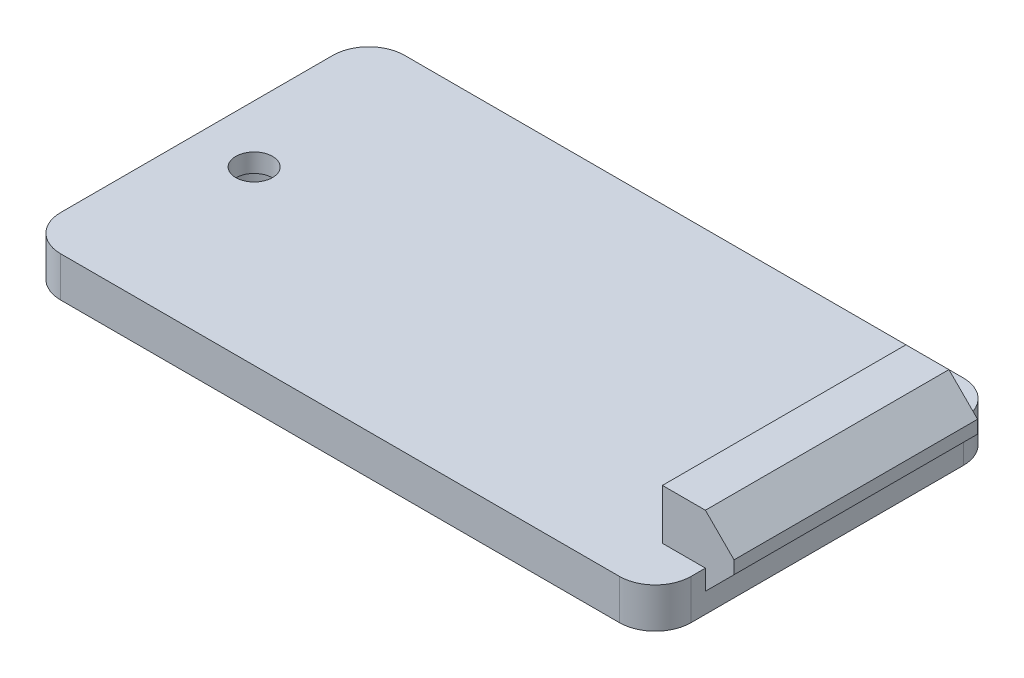
from build123d import *

# Parameters (mm, degrees)
SKETCH1_R           = 1.63195
BOSS_EXTRUDE1_DEPTH = 3.556
SKETCH2_R           = 3.175
SKETCH2_R_2         = 1.63195
CUT_EXTRUDE1_DEPTH  = 1.905
SKETCH3_W           = 21.59
SKETCH3_H           = 6.604
BOSS_EXTRUDE2_DEPTH = 2.54
CHAMFER1_SIZE       = 2.7305
SKETCH4_W           = 21.59
SKETCH4_H           = 4.445
BOSS_EXTRUDE3_DEPTH = 3.81
CUT_EXTRUDE2_DEPTH  = 1.778
CUT_EXTRUDE3_DEPTH  = 1.016


with BuildPart() as part:
    # Sketch1 → Boss-Extrude1 (new body)
    with BuildSketch(Plane(origin=(0, 0, 0), x_dir=(1, 0, 0), z_dir=(0, 1, 0))):
        with BuildLine():
            Line((3.175, 0), (52.705, 0))
            ThreePointArc((52.705, 0), (54.95006403, 0.92993597), (55.88, 3.175))
            Line((55.88, 3.175), (55.88, 27.305))
            ThreePointArc((55.88, 27.305), (54.95006403, 29.55006403), (52.705, 30.48))
            Line((52.705, 30.48), (3.175, 30.48))
            ThreePointArc((3.175, 30.48), (0.92993597, 29.55006403), (0, 27.305))
            Line((0, 27.305), (0, 3.175))
            ThreePointArc((0, 3.175), (0.92993597, 0.92993597), (3.175, 0))
        make_face()
        with Locations(Location((5.08, 15.24, 0), (0, 0, 270))):
            Circle(SKETCH1_R, mode=Mode.SUBTRACT)
    extrude(amount=BOSS_EXTRUDE1_DEPTH)

    # Sketch2 → Cut-Extrude1 (cut)
    with BuildSketch(Plane.XZ):
        with Locations(Location((5.08, -15.24, 0), (0, 0, 270))):
            Circle(SKETCH2_R)
        with Locations(Location((5.08, -15.24, 0), (0, 0, 270))):
            Circle(SKETCH2_R_2, mode=Mode.SUBTRACT)
    extrude(amount=-CUT_EXTRUDE1_DEPTH, mode=Mode.SUBTRACT)

    # Sketch3 → Boss-Extrude2 (add)
    with BuildSketch(Plane(origin=(55.88, 0, 0), x_dir=(0, 0, -1), z_dir=(1, 0, 0))):
        with Locations((15.24, 4.8895)):
            Rectangle(SKETCH3_W, SKETCH3_H)
    extrude(amount=BOSS_EXTRUDE2_DEPTH)

    # Chamfer1
    # the kernel refuses this chamfer: 2.7305 mm, written as the material it takes off along each edge
    with BuildSketch(Plane(origin=(58.42, 1.5875, 2.576980399), x_dir=(-0.9996219169112968, -0.027495876610586327, 0), z_dir=(0, 0, -1))) as chamfer1_piece_1_section:
        Polygon((CHAMFER1_SIZE * 0.999621916911, CHAMFER1_SIZE * 0.0274958766106), (-CHAMFER1_SIZE * 0.0274958766106, CHAMFER1_SIZE * 0.999621916911), (0, 0), align=None)
    chamfer1_piece_1 = extrude(amount=35.633960797, mode=Mode.PRIVATE)
    chamfer1_piece_1 = split(chamfer1_piece_1, bisect_by=Plane(origin=(55.88, 2.498762028, -15.24), z_dir=(1, 0, 0)), keep=Keep.TOP, mode=Mode.PRIVATE)
    add(chamfer1_piece_1, mode=Mode.SUBTRACT)
    with BuildSketch(Plane(origin=(58.42, 8.1915, -33.056980399), x_dir=(-0.9996219169112968, 0.027495876610586327, 0), z_dir=(0, 0, 1))) as chamfer1_piece_2:
        Polygon((CHAMFER1_SIZE * 0.999621916911, CHAMFER1_SIZE * 0.0274958766106), (-CHAMFER1_SIZE * 0.0274958766106, CHAMFER1_SIZE * 0.999621916911), (0, 0), align=None)
    extrude(amount=35.633960797, mode=Mode.SUBTRACT)

    # Sketch4 → Boss-Extrude3 (add)
    with BuildSketch(Plane.ZY.offset(-55.88)):
        with Locations((-15.24, 5.7785)):
            Rectangle(SKETCH4_W, SKETCH4_H)
    extrude(amount=BOSS_EXTRUDE3_DEPTH)

    # Sketch5 → Cut-Extrude2 (cut)
    with BuildSketch(Plane.XZ):
        with BuildLine():
            Line((11.1125, -8.89), (11.143328177, -21.901334365))
            ThreePointArc((11.143328177, -21.901334365), (12.7, -23.1775), (14.256671823, -21.901334365))
            Line((14.256671823, -21.901334365), (14.2875, -8.89))
            ThreePointArc((14.2875, -8.89), (12.7, -7.3025), (11.1125, -8.89))
        make_face()
    extrude(amount=-CUT_EXTRUDE2_DEPTH, mode=Mode.SUBTRACT)

    # Sketch6 → Cut-Extrude3 (cut)
    # profile 1 of 6: a face of its own
    with BuildSketch(Plane.XZ):
        with BuildLine():
            Line((20.72589216, -17.220654297), (18.610052316, -13.731875))
            Line((18.610052316, -13.731875), (18.610052316, -17.239257812))
            add(Edge.make_bspline(
                [(18.610052316, -17.239257812), (18.607921605, -17.298911648), (18.603908362, -17.41127099), (18.573988826, -17.569982619), (18.518975798, -17.705796144), (18.444521967, -17.819701414), (18.350307706, -17.908840339), (18.240659525, -17.973288208), (18.115205248, -18.011784183), (18.027003727, -18.015959341), (17.981253488, -18.018125)],
                knots=[0, 0, 0, 0, 1.265353785, 2.383322319, 3.406079062, 4.354706819, 5.248049079, 6.132478892, 7.031314469, 8, 8, 8, 8], degree=3))
            add(Edge.make_bspline(
                [(17.981253488, -18.018125), (17.925628944, -18.01557639), (17.819929267, -18.010733433), (17.670961125, -17.972499343), (17.543370335, -17.905481858), (17.438491924, -17.811943402), (17.358521489, -17.695032319), (17.30155081, -17.560029656), (17.26595508, -17.407673383), (17.262486044, -17.300235819), (17.260677316, -17.24421875)],
                knots=[0, 0, 0, 0, 1.111277701, 2.111688183, 3.047130546, 3.966217245, 4.892522741, 5.855174746, 6.8817056, 8, 8, 8, 8], degree=3))
            Line((17.260677316, -17.24421875), (17.260677316, -12.536289063))
            add(Edge.make_bspline(
                [(17.260677316, -12.536289063), (17.262572187, -12.468256972), (17.266143267, -12.340043456), (17.305206073, -12.160989669), (17.366968544, -12.007029198), (17.459285684, -11.881642903), (17.576090377, -11.7829468), (17.720352388, -11.715970397), (17.888415477, -11.674546085), (18.009096159, -11.670348704), (18.073030832, -11.668125)],
                knots=[0, 0, 0, 0, 1.196794268, 2.255482655, 3.211935605, 4.097712834, 4.971580063, 5.877259559, 6.875406449, 8, 8, 8, 8], degree=3))
            add(Edge.make_bspline(
                [(18.073030832, -11.668125), (18.130369187, -11.669974867), (18.239975638, -11.673511024), (18.396474454, -11.715522058), (18.538882737, -11.783332619), (18.665877229, -11.881691636), (18.783774274, -11.997589871), (18.88701186, -12.132784611), (18.988065823, -12.273318658), (19.053455797, -12.369934821), (19.086302316, -12.418466797)],
                knots=[0, 0, 0, 0, 1.034588742, 1.977691896, 2.907420409, 3.869016966, 4.868336302, 5.890146147, 6.940183772, 8, 8, 8, 8], degree=3))
            Line((19.086302316, -12.418466797), (21.150052316, -15.875))
            Line((21.150052316, -15.875), (21.150052316, -12.44203125))
            add(Edge.make_bspline(
                [(21.150052316, -12.44203125), (21.152431613, -12.386450379), (21.15699279, -12.279900325), (21.191785167, -12.127790172), (21.251752435, -11.993426334), (21.334496775, -11.876997955), (21.439132723, -11.78285203), (21.564998668, -11.715507081), (21.709047408, -11.675376644), (21.811245079, -11.670607037), (21.864427316, -11.668125)],
                knots=[0, 0, 0, 0, 1.120944038, 2.148880464, 3.127180073, 4.071713149, 5.011111752, 5.94053073, 6.928281018, 8, 8, 8, 8], degree=3))
            add(Edge.make_bspline(
                [(21.864427316, -11.668125), (21.91062512, -11.670167989), (21.999825012, -11.674112644), (22.125749833, -11.714254018), (22.236559279, -11.77883351), (22.330904459, -11.868964724), (22.407145441, -11.982184448), (22.461518851, -12.117301231), (22.493732847, -12.273104653), (22.497456779, -12.383575212), (22.499427316, -12.44203125)],
                knots=[0, 0, 0, 0, 0.978985233, 1.890249527, 2.776095748, 3.683286574, 4.638334066, 5.654599251, 6.75891969, 8, 8, 8, 8], degree=3))
            Line((22.499427316, -12.44203125), (22.499427316, -17.060664063))
            add(Edge.make_bspline(
                [(22.499427316, -17.060664063), (22.499074635, -17.109502482), (22.49840354, -17.202434049), (22.483796167, -17.333215501), (22.465145225, -17.449101652), (22.44121423, -17.518133426), (22.429974191, -17.550556641)],
                knots=[0, 0, 0, 0, 1.177360908, 2.240326254, 3.173506975, 4, 4, 4, 4], degree=3))
            add(Edge.make_bspline(
                [(22.429974191, -17.550556641), (22.41465325, -17.584334411), (22.384257523, -17.65134726), (22.316681693, -17.739976372), (22.239232274, -17.821507427), (22.147044921, -17.889894057), (22.047785728, -17.946839535), (21.942346783, -17.988843564), (21.831987519, -18.012535286), (21.757046771, -18.016253278), (21.719319894, -18.018125)],
                knots=[0, 0, 0, 0, 0.986319285, 1.956791804, 2.954998574, 3.978349394, 5.005554879, 6.000772542, 6.993543447, 8, 8, 8, 8], degree=3))
            add(Edge.make_bspline(
                [(21.719319894, -18.018125), (21.685392022, -18.016994956), (21.619785435, -18.01480978), (21.524768584, -18.003081997), (21.437061413, -17.980363416), (21.332344195, -17.940045949), (21.218113011, -17.874037149), (21.101294302, -17.77750425), (21.006614452, -17.662756973), (20.91818128, -17.533505848), (20.827942882, -17.383055192), (20.761657606, -17.277570507), (20.72589216, -17.220654297)],
                knots=[0, 0, 0, 0, 0.753527253, 1.45710146, 2.120494025, 2.759698616, 3.943682189, 5.031898768, 6.106090348, 7.233993655, 8.507550168, 10, 10, 10, 10], degree=3))
        make_face()
    # profile 2 of 6: a face of its own
    with BuildSketch(Plane.XZ):
        with BuildLine():
            Line((25.277552316, -12.486679688), (25.277552316, -17.203291016))
            add(Edge.make_bspline(
                [(25.277552316, -17.203291016), (25.27592243, -17.265925971), (25.272836346, -17.384521173), (25.236417882, -17.550195902), (25.178343797, -17.693368917), (25.095879346, -17.811117041), (24.994601679, -17.903633987), (24.878895024, -17.970767998), (24.748005393, -18.010523035), (24.656472252, -18.015531202), (24.609065988, -18.018125)],
                knots=[0, 0, 0, 0, 1.262742683, 2.390920895, 3.404851053, 4.363640381, 5.267702689, 6.154016717, 7.043940042, 8, 8, 8, 8], degree=3))
            add(Edge.make_bspline(
                [(24.609065988, -18.018125), (24.551735633, -18.015825108), (24.442466159, -18.011441602), (24.288525009, -17.969590153), (24.15467477, -17.900387033), (24.042725158, -17.803300543), (23.954988046, -17.682001274), (23.892405557, -17.539612979), (23.855133108, -17.377573821), (23.850972231, -17.26302745), (23.848802316, -17.203291016)],
                knots=[0, 0, 0, 0, 1.087566885, 2.072861081, 3.00405413, 3.928595716, 4.861973346, 5.825543248, 6.866011271, 8, 8, 8, 8], degree=3))
            Line((23.848802316, -17.203291016), (23.848802316, -12.486679688))
            add(Edge.make_bspline(
                [(23.848802316, -12.486679688), (23.850878705, -12.426507333), (23.854833255, -12.311907179), (23.892940171, -12.149733878), (23.954556383, -12.006924722), (24.043114705, -11.885401216), (24.154546654, -11.78721554), (24.288208758, -11.71642014), (24.442502872, -11.674891738), (24.551748267, -11.670453571), (24.609065988, -11.668125)],
                knots=[0, 0, 0, 0, 1.139519022, 2.170250048, 3.139037528, 4.070529348, 4.998351585, 5.931326961, 6.914630453, 8, 8, 8, 8], degree=3))
            add(Edge.make_bspline(
                [(24.609065988, -11.668125), (24.656027131, -11.670802883), (24.747084043, -11.675995256), (24.877807151, -11.714907406), (24.9924996, -11.78475118), (25.094189863, -11.877413036), (25.178899012, -11.9952127), (25.236042957, -12.139541067), (25.272923116, -12.305407691), (25.275952418, -12.424030272), (25.277552316, -12.486679688)],
                knots=[0, 0, 0, 0, 0.946211755, 1.834689595, 2.716576145, 3.630944128, 4.592989355, 5.612962632, 6.739308366, 8, 8, 8, 8], degree=3))
        make_face()
    # profile 3 of 6: a face of its own
    with BuildSketch(Plane.XZ):
        with BuildLine():
            Line((28.719202707, -14.049375), (29.722552316, -14.049375))
            Line((29.722552316, -14.049375), (29.722552316, -12.470556641))
            add(Edge.make_bspline(
                [(29.722552316, -12.470556641), (29.724534097, -12.412417099), (29.728334293, -12.300930641), (29.768242575, -12.143579632), (29.83000355, -12.003458996), (29.919395921, -11.88430312), (30.030726632, -11.788012019), (30.161737243, -11.716276224), (30.312557208, -11.675251522), (30.418900785, -11.670561132), (30.474134347, -11.668125)],
                knots=[0, 0, 0, 0, 1.122355115, 2.152190969, 3.118405591, 4.066785803, 5.007856095, 5.945352367, 6.932840986, 8, 8, 8, 8], degree=3))
            add(Edge.make_bspline(
                [(30.474134347, -11.668125), (30.523158376, -11.67074995), (30.617470626, -11.675799818), (30.752322877, -11.71464672), (30.869464937, -11.784086924), (30.971902078, -11.876734591), (31.053040047, -11.995822735), (31.111634092, -12.13793825), (31.146066876, -12.302742611), (31.149495383, -12.419947837), (31.151302316, -12.48171875)],
                knots=[0, 0, 0, 0, 0.983270993, 1.891613195, 2.783860355, 3.694132988, 4.64233434, 5.650083691, 6.761518737, 8, 8, 8, 8], degree=3))
            Line((31.151302316, -12.48171875), (31.151302316, -17.112753906))
            add(Edge.make_bspline(
                [(31.151302316, -17.112753906), (31.150557113, -17.147921657), (31.149116201, -17.21592145), (31.138969838, -17.314128197), (31.123572291, -17.40523666), (31.099687684, -17.488572809), (31.070430124, -17.564513445), (31.03379822, -17.632838991), (30.990823027, -17.693641692), (30.939947165, -17.746693457), (30.882943229, -17.792757683), (30.818228499, -17.8313101), (30.747408095, -17.865082145), (30.668731417, -17.892137801), (30.583176484, -17.913070602), (30.490613695, -17.927348788), (30.391291146, -17.938175471), (30.322445237, -17.938554224), (30.286858957, -17.93875)],
                knots=[0, 0, 0, 0, 1.221278598, 2.361444476, 3.426145967, 4.426137594, 5.36739449, 6.247523005, 7.11217111, 7.944995601, 8.792665742, 9.649649225, 10.555293995, 11.513484454, 12.533886177, 13.610335656, 14.764788421, 16, 16, 16, 16], degree=3))
            Line((30.286858957, -17.93875), (28.696878488, -17.93875))
            add(Edge.make_bspline(
                [(28.696878488, -17.93875), (28.63733862, -17.938770336), (28.521530021, -17.938809892), (28.35327436, -17.931708938), (28.195666811, -17.923723531), (28.049235983, -17.911362005), (27.913528606, -17.895369777), (27.788556863, -17.875691897), (27.674126133, -17.852792981), (27.602479616, -17.832905407), (27.568265207, -17.823408203)],
                knots=[0, 0, 0, 0, 1.255546722, 2.442113353, 3.55108982, 4.583603624, 5.540695078, 6.432281546, 7.251344479, 8, 8, 8, 8], degree=3))
            add(Edge.make_bspline(
                [(27.568265207, -17.823408203), (27.500755307, -17.801263339), (27.368886628, -17.758007253), (27.183379786, -17.670203303), (27.01560331, -17.564839695), (26.865127372, -17.44237364), (26.734284949, -17.304022), (26.618516584, -17.154186591), (26.52175715, -16.991244082), (26.443585209, -16.816233568), (26.382305073, -16.630972473), (26.341527952, -16.43573377), (26.314043459, -16.232551811), (26.310983706, -16.094201906), (26.309427316, -16.023828125)],
                knots=[0, 0, 0, 0, 1.077512528, 2.104730614, 3.10566762, 4.07775356, 5.040745925, 5.989467896, 6.946061842, 7.909299451, 8.893419455, 9.90131328, 10.932471113, 12, 12, 12, 12], degree=3))
            add(Edge.make_bspline(
                [(26.309427316, -16.023828125), (26.311440122, -15.947265253), (26.315359345, -15.798186358), (26.34270653, -15.580866431), (26.388932265, -15.37679733), (26.457237823, -15.186958502), (26.540936707, -15.009156482), (26.646191962, -14.845839135), (26.769876255, -14.696069257), (26.912086491, -14.559581657), (27.074530491, -14.439833778), (27.25408045, -14.332901148), (27.45374179, -14.245850601), (27.671394373, -14.173928031), (27.906907869, -14.116801606), (28.161753658, -14.078509352), (28.434239225, -14.052602179), (28.622399423, -14.050471286), (28.719202707, -14.049375)],
                knots=[0, 0, 0, 0, 1.035424291, 2.016119615, 2.957447367, 3.859422543, 4.739785344, 5.60994934, 6.479825834, 7.361767666, 8.268738058, 9.203750283, 10.182546781, 11.20812534, 12.30123455, 13.455882363, 14.691120951, 16, 16, 16, 16], degree=3))
        make_face()
        with BuildLine():
            Line((29.026780832, -16.8275), (29.722552316, -16.8275))
            Line((29.722552316, -16.8275), (29.722552316, -15.160625))
            Line((29.722552316, -15.160625), (29.026780832, -15.160625))
            add(Edge.make_bspline(
                [(29.026780832, -15.160625), (28.956875593, -15.161349265), (28.823473109, -15.162731405), (28.633360539, -15.179223423), (28.462323147, -15.20426242), (28.310115328, -15.241042016), (28.175665806, -15.2890838), (28.058782264, -15.349423339), (27.960289535, -15.424082976), (27.87763755, -15.51012807), (27.814887986, -15.611819434), (27.769828318, -15.727250858), (27.742242429, -15.857589034), (27.739571996, -15.949684659), (27.738177316, -15.997783203)],
                knots=[0, 0, 0, 0, 1.435495954, 2.739404517, 3.916352686, 4.983199812, 5.950282577, 6.842919392, 7.673412711, 8.47837746, 9.279481015, 10.110495128, 11.013173168, 12, 12, 12, 12], degree=3))
            add(Edge.make_bspline(
                [(27.738177316, -15.997783203), (27.74036203, -16.055594393), (27.744576448, -16.167114991), (27.789359997, -16.324698298), (27.855896647, -16.468253335), (27.924619597, -16.545725412), (27.958939035, -16.584414062)],
                knots=[0, 0, 0, 0, 1.076252035, 2.076142518, 3.039248046, 4, 4, 4, 4], degree=3))
            add(Edge.make_bspline(
                [(27.958939035, -16.584414062), (27.982317945, -16.604268404), (28.031709045, -16.646213378), (28.122934653, -16.69504677), (28.230931247, -16.735016685), (28.355585333, -16.770337035), (28.498700885, -16.794607654), (28.658748231, -16.815061529), (28.836889035, -16.825482632), (28.961451623, -16.826805957), (29.026780832, -16.8275)],
                knots=[0, 0, 0, 0, 0.65761339, 1.389296936, 2.207585142, 3.130093497, 4.168580527, 5.323323081, 6.596166095, 8, 8, 8, 8], degree=3))
        make_face(mode=Mode.SUBTRACT)
    # profile 4 of 6: a face of its own
    with BuildSketch(Plane.XZ):
        with BuildLine():
            Line((38.518294504, -12.836425781), (39.247552316, -16.51))
            Line((39.247552316, -16.51), (39.247552316, -12.437070313))
            add(Edge.make_bspline(
                [(39.247552316, -12.437070313), (39.249388218, -12.381474636), (39.252908579, -12.274869355), (39.288165388, -12.123440372), (39.346674649, -11.98973906), (39.428277256, -11.874499693), (39.532427752, -11.781074391), (39.659005439, -11.713715923), (39.805984671, -11.675733363), (39.910029579, -11.670736545), (39.964407785, -11.668125)],
                knots=[0, 0, 0, 0, 1.118795352, 2.145301603, 3.11123883, 4.04283504, 4.969164682, 5.904626452, 6.904870441, 8, 8, 8, 8], degree=3))
            add(Edge.make_bspline(
                [(39.964407785, -11.668125), (40.009289773, -11.670477739), (40.096462842, -11.675047401), (40.220709104, -11.711396739), (40.330060328, -11.774541895), (40.425791874, -11.859793947), (40.50421265, -11.97033825), (40.559581527, -12.105440203), (40.591166084, -12.263651425), (40.594930292, -12.37614753), (40.596927316, -12.435830078)],
                knots=[0, 0, 0, 0, 0.957205531, 1.85915439, 2.732677191, 3.632681029, 4.575498453, 5.599913534, 6.726682339, 8, 8, 8, 8], degree=3))
            Line((40.596927316, -12.435830078), (40.596927316, -17.190888672))
            add(Edge.make_bspline(
                [(40.596927316, -17.190888672), (40.59630391, -17.225657442), (40.595098158, -17.292904998), (40.583400791, -17.388999821), (40.567327355, -17.477203949), (40.540096138, -17.555626583), (40.509310769, -17.627366144), (40.467203112, -17.68831314), (40.419969428, -17.741800989), (40.34546246, -17.799493171), (40.238589994, -17.857058883), (40.094585293, -17.904831469), (39.933288058, -17.933500109), (39.820251949, -17.936944686), (39.761009347, -17.93875)],
                knots=[0, 0, 0, 0, 0.966329946, 1.869014259, 2.689713562, 3.453177714, 4.173437529, 4.852613119, 5.50377135, 6.150141963, 7.462215634, 8.858283304, 10.353415795, 12, 12, 12, 12], degree=3))
            Line((39.761009347, -17.93875), (39.385218332, -17.93875))
            add(Edge.make_bspline(
                [(39.385218332, -17.93875), (39.324804376, -17.938126287), (39.211583768, -17.936957399), (39.053351017, -17.920069754), (38.917353914, -17.897334572), (38.802717042, -17.861295739), (38.707321382, -17.813354747), (38.627467249, -17.754992652), (38.564050263, -17.683522609), (38.513768382, -17.598596351), (38.474347849, -17.495670742), (38.431940244, -17.374141234), (38.389001212, -17.229469055), (38.360942167, -17.125223516), (38.345901926, -17.069345703)],
                knots=[0, 0, 0, 0, 1.408819075, 2.64024018, 3.709187496, 4.621266552, 5.432262019, 6.190426418, 6.914570403, 7.64574694, 8.480487182, 9.481052791, 10.649791034, 12, 12, 12, 12], degree=3))
            Line((38.345901926, -17.069345703), (37.583157785, -13.81125))
            Line((37.583157785, -13.81125), (36.824134347, -17.069345703))
            add(Edge.make_bspline(
                [(36.824134347, -17.069345703), (36.808056608, -17.127640411), (36.777999516, -17.236621492), (36.735497208, -17.388274874), (36.689534063, -17.513206923), (36.649939955, -17.617410088), (36.602843243, -17.702853185), (36.543330659, -17.771783033), (36.472656067, -17.829556317), (36.386393263, -17.871947105), (36.283723323, -17.902728199), (36.161424021, -17.924469041), (36.016947429, -17.935640776), (35.913406065, -17.937666079), (35.857991769, -17.93875)],
                knots=[0, 0, 0, 0, 1.467539927, 2.743543835, 3.819154281, 4.696545863, 5.446826912, 6.17256448, 6.893223249, 7.646916661, 8.48770351, 9.487228438, 10.655189935, 12, 12, 12, 12], degree=3))
            Line((35.857991769, -17.93875), (35.480960519, -17.93875))
            add(Edge.make_bspline(
                [(35.480960519, -17.93875), (35.41507296, -17.937276309), (35.289032629, -17.934457197), (35.110470629, -17.901500087), (34.951885107, -17.850159135), (34.835114056, -17.7888455), (34.755582245, -17.726892318), (34.70391268, -17.672797049), (34.660631962, -17.610776631), (34.625784635, -17.540733105), (34.596658251, -17.464602896), (34.57930261, -17.379563159), (34.565883254, -17.288053375), (34.564923757, -17.224019567), (34.564427316, -17.190888672)],
                knots=[0, 0, 0, 0, 1.74818082, 3.344201675, 4.802644787, 6.16366346, 6.820504638, 7.472925074, 8.143123404, 8.820836206, 9.546992226, 10.300929114, 11.120905953, 12, 12, 12, 12], degree=3))
            Line((34.564427316, -17.190888672), (34.564427316, -12.435830078))
            add(Edge.make_bspline(
                [(34.564427316, -12.435830078), (34.566282723, -12.380242709), (34.569840484, -12.273653355), (34.604753916, -12.122485223), (34.663903687, -11.989477827), (34.745137555, -11.874526511), (34.849503971, -11.7806724), (34.976879442, -11.714034665), (35.124872391, -11.67545343), (35.229780462, -11.670652292), (35.285003488, -11.668125)],
                knots=[0, 0, 0, 0, 1.116513993, 2.140927073, 3.097300681, 4.026997254, 4.951437997, 5.892329682, 6.890534052, 8, 8, 8, 8], degree=3))
            add(Edge.make_bspline(
                [(35.285003488, -11.668125), (35.329050945, -11.670520581), (35.414982855, -11.675194105), (35.538255954, -11.711463277), (35.646969965, -11.775931505), (35.742779265, -11.862313525), (35.820414378, -11.97360664), (35.876797323, -12.108173276), (35.907879278, -12.265761303), (35.911753582, -12.377815812), (35.913802316, -12.437070313)],
                knots=[0, 0, 0, 0, 0.94263134, 1.838973633, 2.719701624, 3.628506077, 4.581557204, 5.601087401, 6.731453385, 8, 8, 8, 8], degree=3))
            Line((35.913802316, -12.437070313), (35.913802316, -16.51))
            Line((35.913802316, -16.51), (36.648021066, -12.737207031))
            add(Edge.make_bspline(
                [(36.648021066, -12.737207031), (36.662365758, -12.683843141), (36.689314408, -12.583591092), (36.729196986, -12.44265851), (36.765469692, -12.320382578), (36.796763221, -12.211673807), (36.837371011, -12.112453912), (36.895564806, -12.019407883), (36.969814308, -11.928798463), (37.058143316, -11.839745839), (37.167282193, -11.761876518), (37.299709198, -11.705299429), (37.453559308, -11.674076448), (37.562756938, -11.670180389), (37.620364816, -11.668125)],
                knots=[0, 0, 0, 0, 1.240862499, 2.331145807, 3.288828463, 4.105139969, 4.870673911, 5.687460369, 6.55882103, 7.497553096, 8.496895322, 9.548880009, 10.706896625, 12, 12, 12, 12], degree=3))
            add(Edge.make_bspline(
                [(37.620364816, -11.668125), (37.658922048, -11.669071546), (37.733286942, -11.670897139), (37.839901391, -11.691786231), (37.937954457, -11.722981744), (38.024836357, -11.770319612), (38.102847123, -11.824654409), (38.172221185, -11.885709838), (38.230721135, -11.954720822), (38.296632698, -12.054769113), (38.362781992, -12.19144406), (38.410563961, -12.338861765), (38.442740541, -12.467846098), (38.469146657, -12.578413588), (38.493189665, -12.7032104), (38.509645801, -12.790532627), (38.518294504, -12.836425781)],
                knots=[0, 0, 0, 0, 0.989735106, 1.908890824, 2.78263162, 3.624043037, 4.440661542, 5.223458556, 5.992281128, 6.758602499, 8.298449417, 9.877903933, 10.733622133, 11.715740033, 12.799482111, 14, 14, 14, 14], degree=3))
        make_face()
    # profile 5 of 6: a face of its own
    with BuildSketch(Plane.XZ):
        with BuildLine():
            Line((41.708177316, -14.258974609), (41.708177316, -13.130361328))
            add(Edge.make_bspline(
                [(41.708177316, -13.130361328), (41.708365887, -13.095188306), (41.708728358, -13.027578521), (41.719397544, -12.931113826), (41.733517267, -12.843850956), (41.754478166, -12.76485686), (41.785349428, -12.691855034), (41.825956985, -12.622849654), (41.878447679, -12.556866468), (41.942284259, -12.49394357), (42.017556798, -12.431542043), (42.104644187, -12.370120606), (42.202932084, -12.307603135), (42.273892616, -12.268805518), (42.310931222, -12.248554688)],
                knots=[0, 0, 0, 0, 1.104637494, 2.123340523, 3.046056853, 3.881300864, 4.684820303, 5.529309356, 6.389640147, 7.326696786, 8.341415302, 9.459041383, 10.673719557, 12, 12, 12, 12], degree=3))
            add(Edge.make_bspline(
                [(42.310931222, -12.248554688), (42.400466958, -12.201448096), (42.577037893, -12.108550496), (42.848537175, -11.992083137), (43.117334801, -11.890209354), (43.38845045, -11.80909969), (43.664913668, -11.744482315), (43.952309857, -11.700968173), (44.251322712, -11.672535005), (44.454815572, -11.669611037), (44.55823591, -11.668125)],
                knots=[0, 0, 0, 0, 1.034210206, 2.039537209, 3.018756018, 3.972370203, 4.931227121, 5.919593079, 6.942683356, 8, 8, 8, 8], degree=3))
            add(Edge.make_bspline(
                [(44.55823591, -11.668125), (44.675779591, -11.670572637), (44.905819772, -11.675362813), (45.242189315, -11.717934682), (45.562777554, -11.78343355), (45.865552053, -11.87973182), (46.150484467, -11.999558956), (46.415391446, -12.144633841), (46.657337686, -12.317775478), (46.879102718, -12.513511849), (47.076390918, -12.73451442), (47.251785977, -12.975904103), (47.399306564, -13.241421544), (47.523180948, -13.526729173), (47.621462365, -13.831088689), (47.690179322, -14.153556801), (47.733579735, -14.492604939), (47.738280464, -14.724754414), (47.740677316, -14.843125)],
                knots=[0, 0, 0, 0, 1.110355561, 2.17303381, 3.198998897, 4.198590959, 5.170192207, 6.116188142, 7.046295614, 7.976140491, 8.905673443, 9.840331706, 10.790127677, 11.769941439, 12.775630185, 13.807047936, 14.881836705, 16, 16, 16, 16], degree=3))
            add(Edge.make_bspline(
                [(47.740677316, -14.843125), (47.738229581, -14.959844587), (47.733431234, -15.188652499), (47.690605193, -15.524136059), (47.625442338, -15.845201934), (47.528877674, -16.149073758), (47.409770533, -16.43609394), (47.261224096, -16.70102462), (47.088153057, -16.9449593), (46.888692606, -17.165531356), (46.664616918, -17.361510617), (46.417915429, -17.534632026), (46.147939572, -17.681529415), (45.856676294, -17.805228874), (45.54374949, -17.899828431), (45.211895222, -17.9693903), (44.859832189, -18.010742753), (44.61870588, -18.015621642), (44.494983957, -18.018125)],
                knots=[0, 0, 0, 0, 1.089264675, 2.135308937, 3.152690976, 4.143921646, 5.107372469, 6.049093138, 6.973377758, 7.89429571, 8.818725378, 9.747086839, 10.702315199, 11.682991842, 12.696339109, 13.749303254, 14.845167362, 16, 16, 16, 16], degree=3))
            add(Edge.make_bspline(
                [(44.494983957, -18.018125), (44.389886803, -18.016020646), (44.184966873, -18.011917546), (43.886431183, -17.978916653), (43.604762274, -17.926817728), (43.342633465, -17.850699382), (43.101408865, -17.758996148), (42.882157065, -17.656931333), (42.68759041, -17.542406432), (42.516709266, -17.41866937), (42.370185444, -17.285542712), (42.242128749, -17.151373521), (42.133807922, -17.013632583), (42.046769361, -16.87464707), (41.978139247, -16.738777341), (41.929699937, -16.61030056), (41.898408325, -16.490391325), (41.893889941, -16.413010869), (41.891732004, -16.376054688)],
                knots=[0, 0, 0, 0, 1.504498947, 2.933493525, 4.295302359, 5.601154716, 6.835780476, 7.98765373, 9.059722477, 10.06375573, 11.002702629, 11.890431698, 12.716961413, 13.506944282, 14.234947678, 14.892439713, 15.471039583, 16, 16, 16, 16], degree=3))
            add(Edge.make_bspline(
                [(41.891732004, -16.376054688), (41.893893353, -16.33723716), (41.898240127, -16.259169706), (41.941506817, -16.146622397), (42.007364766, -16.03938981), (42.097330679, -15.940633562), (42.206665262, -15.854827099), (42.334253977, -15.791538959), (42.477231047, -15.755410098), (42.57696368, -15.750849575), (42.628431222, -15.748496094)],
                knots=[0, 0, 0, 0, 0.866900342, 1.743457294, 2.666969674, 3.677573396, 4.721292999, 5.765794153, 6.847026497, 8, 8, 8, 8], degree=3))
            add(Edge.make_bspline(
                [(42.628431222, -15.748496094), (42.677653739, -15.75155453), (42.776441609, -15.757692706), (42.917281222, -15.809108118), (43.048043106, -15.885746279), (43.116245389, -15.96027484), (43.150569894, -15.997783203)],
                knots=[0, 0, 0, 0, 0.986558231, 1.97998787, 2.983378339, 4, 4, 4, 4], degree=3))
            add(Edge.make_bspline(
                [(43.150569894, -15.997783203), (43.187128659, -16.051682972), (43.255761591, -16.152870722), (43.355642872, -16.292666418), (43.448151561, -16.408504109), (43.529901642, -16.509384135), (43.616889723, -16.593317509), (43.712875797, -16.668458087), (43.82335228, -16.734905191), (43.946010522, -16.796634751), (44.085614008, -16.846728636), (44.242955892, -16.882137849), (44.418371873, -16.902717485), (44.541229046, -16.905449035), (44.605364816, -16.906875)],
                knots=[0, 0, 0, 0, 1.290255518, 2.422237746, 3.401989956, 4.22723831, 4.991733691, 5.791180827, 6.636741333, 7.541393438, 8.507669687, 9.566546062, 10.729651368, 12, 12, 12, 12], degree=3))
            add(Edge.make_bspline(
                [(44.605364816, -16.906875), (44.669130959, -16.905795771), (44.793049293, -16.90369848), (44.97310017, -16.877341667), (45.142549575, -16.838711767), (45.301421415, -16.782330954), (45.450118648, -16.710185096), (45.588193394, -16.621297674), (45.717575354, -16.517832018), (45.83524704, -16.396319103), (45.943863757, -16.260108451), (46.038428783, -16.1057063), (46.119663519, -15.935382785), (46.189437666, -15.749636562), (46.24495619, -15.549244917), (46.284153133, -15.335099238), (46.308200325, -15.108675346), (46.310665043, -14.953567371), (46.311927316, -14.874130859)],
                knots=[0, 0, 0, 0, 1.018788566, 1.979837209, 2.903415841, 3.794092631, 4.669203309, 5.540234778, 6.414671074, 7.312190302, 8.239287162, 9.195069621, 10.200321377, 11.252553523, 12.364001635, 13.520517105, 14.73016541, 16, 16, 16, 16], degree=3))
            add(Edge.make_bspline(
                [(46.311927316, -14.874130859), (46.310648422, -14.789734697), (46.308173586, -14.626416443), (46.284905624, -14.389505267), (46.250286807, -14.168669994), (46.199118051, -13.963696712), (46.134221869, -13.774703071), (46.052812239, -13.601909486), (45.957806857, -13.445016954), (45.847264899, -13.305253433), (45.726048834, -13.180599602), (45.592071595, -13.073158906), (45.447487546, -12.982434613), (45.293000221, -12.907329789), (45.127576885, -12.850229001), (44.95175004, -12.809583181), (44.765254596, -12.784357031), (44.637278291, -12.781059923), (44.571878488, -12.779375)],
                knots=[0, 0, 0, 0, 1.309237309, 2.533555386, 3.690490748, 4.774938818, 5.807603421, 6.786167574, 7.733447837, 8.647182417, 9.545381878, 10.426022093, 11.305259269, 12.188955045, 13.085687158, 14.014652813, 14.985426921, 16, 16, 16, 16], degree=3))
            add(Edge.make_bspline(
                [(44.571878488, -12.779375), (44.501958694, -12.780413634), (44.363895411, -12.782464516), (44.160534907, -12.803298307), (43.963484528, -12.834752132), (43.773760478, -12.881553703), (43.589043537, -12.938032035), (43.408124115, -13.002407283), (43.230330898, -13.075236755), (43.115155599, -13.130998351), (43.057552316, -13.158886719)],
                knots=[0, 0, 0, 0, 1.06458661, 2.10212749, 3.110366078, 4.101511614, 5.07552871, 6.051396101, 7.025433549, 8, 8, 8, 8], degree=3))
            Line((43.057552316, -13.158886719), (43.057552316, -13.97))
            Line((43.057552316, -13.97), (43.950521066, -13.97))
            add(Edge.make_bspline(
                [(43.950521066, -13.97), (44.009727129, -13.971133024), (44.121644171, -13.973274775), (44.279096863, -13.996807857), (44.415757533, -14.034710823), (44.533197584, -14.08666303), (44.627894353, -14.161331965), (44.695135992, -14.261144465), (44.735202515, -14.383392612), (44.738701193, -14.47238718), (44.740550363, -14.519423828)],
                knots=[0, 0, 0, 0, 1.292319596, 2.442867858, 3.46608611, 4.383033575, 5.230533952, 6.062010246, 6.975706667, 8, 8, 8, 8], degree=3))
            add(Edge.make_bspline(
                [(44.740550363, -14.519423828), (44.738558397, -14.558971365), (44.734710939, -14.635356952), (44.700306632, -14.744115788), (44.647083385, -14.842893889), (44.569729688, -14.92687341), (44.477197483, -14.997364236), (44.36704286, -15.045697903), (44.243642681, -15.076380655), (44.156185262, -15.079579453), (44.110511301, -15.08125)],
                knots=[0, 0, 0, 0, 0.999286627, 1.930110007, 2.862816456, 3.819436382, 4.799610189, 5.788472069, 6.845046609, 8, 8, 8, 8], degree=3))
            Line((44.110511301, -15.08125), (42.705325754, -15.08125))
            add(Edge.make_bspline(
                [(42.705325754, -15.08125), (42.659000664, -15.080572991), (42.568690214, -15.079253167), (42.43654633, -15.067892696), (42.311440856, -15.049314477), (42.193299644, -15.024566953), (42.084099794, -14.987525256), (41.988177308, -14.931204491), (41.903565198, -14.861069596), (41.831646876, -14.774099983), (41.775313757, -14.669214752), (41.736857903, -14.547203746), (41.710984501, -14.408883433), (41.70914752, -14.310785246), (41.708177316, -14.258974609)],
                knots=[0, 0, 0, 0, 1.112685319, 2.169172548, 3.183218075, 4.149451026, 5.066670166, 5.93880193, 6.806000429, 7.694822543, 8.632459914, 9.646845799, 10.7571797, 12, 12, 12, 12], degree=3))
        make_face()
    # profile 6 of 6: a face of its own
    with BuildSketch(Plane.XZ):
        with BuildLine():
            Line((50.864827707, -14.049375), (51.868177316, -14.049375))
            Line((51.868177316, -14.049375), (51.868177316, -12.470556641))
            add(Edge.make_bspline(
                [(51.868177316, -12.470556641), (51.870159097, -12.412417099), (51.873959293, -12.300930641), (51.913867575, -12.143579632), (51.97562855, -12.003458996), (52.065020921, -11.88430312), (52.176351632, -11.788012019), (52.307362243, -11.716276224), (52.458182208, -11.675251522), (52.564525785, -11.670561132), (52.619759347, -11.668125)],
                knots=[0, 0, 0, 0, 1.122355115, 2.152190969, 3.118405591, 4.066785803, 5.007856095, 5.945352367, 6.932840986, 8, 8, 8, 8], degree=3))
            add(Edge.make_bspline(
                [(52.619759347, -11.668125), (52.668783376, -11.67074995), (52.763095626, -11.675799818), (52.897947877, -11.71464672), (53.015089937, -11.784086924), (53.117527078, -11.876734591), (53.198665047, -11.995822735), (53.257259092, -12.13793825), (53.291691876, -12.302742611), (53.295120383, -12.419947837), (53.296927316, -12.48171875)],
                knots=[0, 0, 0, 0, 0.983270993, 1.891613195, 2.783860355, 3.694132988, 4.64233434, 5.650083691, 6.761518737, 8, 8, 8, 8], degree=3))
            Line((53.296927316, -12.48171875), (53.296927316, -17.112753906))
            add(Edge.make_bspline(
                [(53.296927316, -17.112753906), (53.296182113, -17.147921657), (53.294741201, -17.21592145), (53.284594838, -17.314128197), (53.269197291, -17.40523666), (53.245312684, -17.488572809), (53.216055124, -17.564513445), (53.17942322, -17.632838991), (53.136448027, -17.693641692), (53.085572165, -17.746693457), (53.028568229, -17.792757683), (52.963853499, -17.8313101), (52.893033095, -17.865082145), (52.814356417, -17.892137801), (52.728801484, -17.913070602), (52.636238695, -17.927348788), (52.536916146, -17.938175471), (52.468070237, -17.938554224), (52.432483957, -17.93875)],
                knots=[0, 0, 0, 0, 1.221278598, 2.361444476, 3.426145967, 4.426137594, 5.36739449, 6.247523005, 7.11217111, 7.944995601, 8.792665742, 9.649649225, 10.555293995, 11.513484454, 12.533886177, 13.610335656, 14.764788421, 16, 16, 16, 16], degree=3))
            Line((52.432483957, -17.93875), (50.842503488, -17.93875))
            add(Edge.make_bspline(
                [(50.842503488, -17.93875), (50.78296362, -17.938770336), (50.667155021, -17.938809892), (50.49889936, -17.931708938), (50.341291811, -17.923723531), (50.194860983, -17.911362005), (50.059153606, -17.895369777), (49.934181863, -17.875691897), (49.819751133, -17.852792981), (49.748104616, -17.832905407), (49.713890207, -17.823408203)],
                knots=[0, 0, 0, 0, 1.255546722, 2.442113353, 3.55108982, 4.583603624, 5.540695078, 6.432281546, 7.251344479, 8, 8, 8, 8], degree=3))
            add(Edge.make_bspline(
                [(49.713890207, -17.823408203), (49.646380307, -17.801263339), (49.514511628, -17.758007253), (49.329004786, -17.670203303), (49.16122831, -17.564839695), (49.010752372, -17.44237364), (48.879909949, -17.304022), (48.764141584, -17.154186591), (48.66738215, -16.991244082), (48.589210209, -16.816233568), (48.527930073, -16.630972473), (48.487152952, -16.43573377), (48.459668459, -16.232551811), (48.456608706, -16.094201906), (48.455052316, -16.023828125)],
                knots=[0, 0, 0, 0, 1.077512528, 2.104730614, 3.10566762, 4.07775356, 5.040745925, 5.989467896, 6.946061842, 7.909299451, 8.893419455, 9.90131328, 10.932471113, 12, 12, 12, 12], degree=3))
            add(Edge.make_bspline(
                [(48.455052316, -16.023828125), (48.457065122, -15.947265253), (48.460984345, -15.798186358), (48.48833153, -15.580866431), (48.534557265, -15.37679733), (48.602862823, -15.186958502), (48.686561707, -15.009156482), (48.791816962, -14.845839135), (48.915501255, -14.696069257), (49.057711491, -14.559581657), (49.220155491, -14.439833778), (49.39970545, -14.332901148), (49.59936679, -14.245850601), (49.817019373, -14.173928031), (50.052532869, -14.116801606), (50.307378658, -14.078509352), (50.579864225, -14.052602179), (50.768024423, -14.050471286), (50.864827707, -14.049375)],
                knots=[0, 0, 0, 0, 1.035424291, 2.016119615, 2.957447367, 3.859422543, 4.739785344, 5.60994934, 6.479825834, 7.361767666, 8.268738058, 9.203750283, 10.182546781, 11.20812534, 12.30123455, 13.455882363, 14.691120951, 16, 16, 16, 16], degree=3))
        make_face()
        with BuildLine():
            Line((51.172405832, -16.8275), (51.868177316, -16.8275))
            Line((51.868177316, -16.8275), (51.868177316, -15.160625))
            Line((51.868177316, -15.160625), (51.172405832, -15.160625))
            add(Edge.make_bspline(
                [(51.172405832, -15.160625), (51.102500593, -15.161349265), (50.969098109, -15.162731405), (50.778985539, -15.179223423), (50.607948147, -15.20426242), (50.455740328, -15.241042016), (50.321290806, -15.2890838), (50.204407264, -15.349423339), (50.105914535, -15.424082976), (50.02326255, -15.51012807), (49.960512986, -15.611819434), (49.915453318, -15.727250858), (49.887867429, -15.857589034), (49.885196996, -15.949684659), (49.883802316, -15.997783203)],
                knots=[0, 0, 0, 0, 1.435495954, 2.739404517, 3.916352686, 4.983199812, 5.950282577, 6.842919392, 7.673412711, 8.47837746, 9.279481015, 10.110495128, 11.013173168, 12, 12, 12, 12], degree=3))
            add(Edge.make_bspline(
                [(49.883802316, -15.997783203), (49.88598703, -16.055594393), (49.890201448, -16.167114991), (49.934984997, -16.324698298), (50.001521647, -16.468253335), (50.070244597, -16.545725412), (50.104564035, -16.584414062)],
                knots=[0, 0, 0, 0, 1.076252035, 2.076142518, 3.039248046, 4, 4, 4, 4], degree=3))
            add(Edge.make_bspline(
                [(50.104564035, -16.584414062), (50.127942945, -16.604268404), (50.177334045, -16.646213378), (50.268559653, -16.69504677), (50.376556247, -16.735016685), (50.501210333, -16.770337035), (50.644325885, -16.794607654), (50.804373231, -16.815061529), (50.982514035, -16.825482632), (51.107076623, -16.826805957), (51.172405832, -16.8275)],
                knots=[0, 0, 0, 0, 0.65761339, 1.389296936, 2.207585142, 3.130093497, 4.168580527, 5.323323081, 6.596166095, 8, 8, 8, 8], degree=3))
        make_face(mode=Mode.SUBTRACT)
    extrude(amount=-CUT_EXTRUDE3_DEPTH, mode=Mode.SUBTRACT)


solid = part.part
